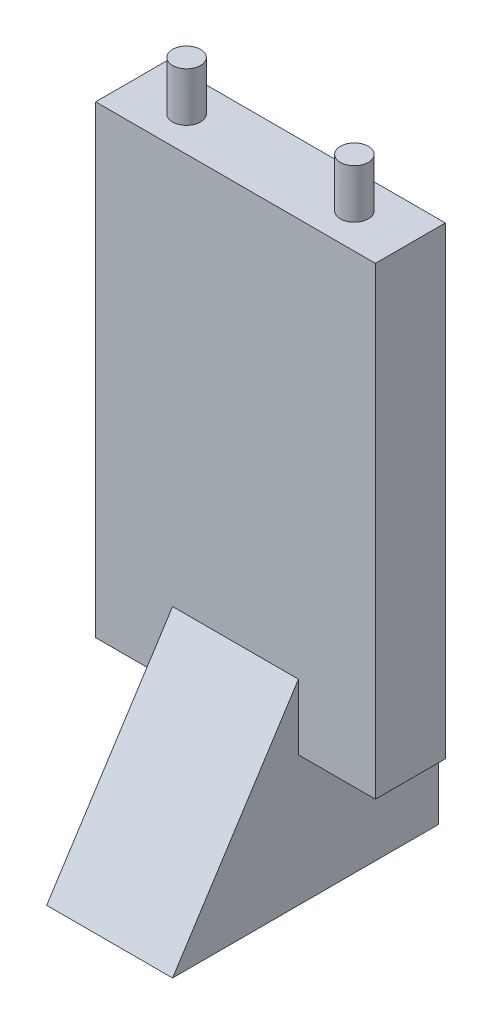
from build123d import *

# Parameters (mm, degrees)
SKETCH1_W           = 101.6
SKETCH1_H           = 25.4
BOSS_EXTRUDE1_DEPTH = 215.9
SKETCH2_R           = 5.08
BOSS_EXTRUDE2_DEPTH = 17.78
SKETCH3_W           = 27.94
SKETCH3_H           = 47.346080225
CUT_EXTRUDE1_DEPTH  = 27.686
SKETCH9_W           = 45.72
SKETCH9_H           = 71.12
BOSS_EXTRUDE5_DEPTH = 45.72
CUT_EXTRUDE4_DEPTH  = 45.72
BOSS_EXTRUDE6_DEPTH = 25.4
SKETCH12_R          = 3.175
CUT_EXTRUDE5_DEPTH  = 12.7


with BuildPart() as part:
    # Sketch1 → Boss-Extrude1 (new body)
    with BuildSketch(Plane(origin=(0, 0, 0), x_dir=(1, 0, 0), z_dir=(0, 1, 0))):
        with Locations((29.457987906, 2.028993953)):
            Rectangle(SKETCH1_W, SKETCH1_H)
    extrude(amount=BOSS_EXTRUDE1_DEPTH)

    # Sketch2 → Boss-Extrude2 (add)
    with BuildSketch(Plane(origin=(0, 215.9, 0), x_dir=(1, 0, 0), z_dir=(0, 1, 0))):
        with Locations((-1.022012094, 2.028993953)):
            Circle(SKETCH2_R)
        with Locations((59.937987906, 2.028993953)):
            Circle(SKETCH2_R)
    extrude(amount=BOSS_EXTRUDE2_DEPTH)

    # Sketch3 → Cut-Extrude1 (cut)
    with BuildSketch(Plane.XY.offset(10.671006047)):
        with Locations((-7.372012094, 23.673040113)):
            Rectangle(SKETCH3_W, SKETCH3_H)
        with Locations((66.287987906, 23.673040113)):
            Rectangle(SKETCH3_W, SKETCH3_H)
    extrude(amount=-CUT_EXTRUDE1_DEPTH, mode=Mode.SUBTRACT)

    # Sketch9 → Boss-Extrude5 (add)
    with BuildSketch(Plane.XY.offset(10.671006047)):
        with Locations((29.457987906, 35.56)):
            Rectangle(SKETCH9_W, SKETCH9_H)
    extrude(amount=BOSS_EXTRUDE5_DEPTH)

    # Sketch10 → Cut-Extrude4 (cut)
    with BuildSketch(Plane(origin=(52.317987906, 0, 0), x_dir=(0, 0, -1), z_dir=(1, 0, 0))):
        Polygon((-56.391006047, 71.12), (-10.671006047, 71.12), (-56.391006047, 0), align=None)
    extrude(amount=-CUT_EXTRUDE4_DEPTH, mode=Mode.SUBTRACT)

    # Sketch11 → Boss-Extrude6 (add)
    with BuildSketch(Plane(origin=(0, 0, -14.728993953), x_dir=(-1, 0, 0), z_dir=(0, 0, -1))):
        Polygon((-52.317987906, 47.346080225), (-52.317987906, 70.979374422), (-6.597987906, 70.979374422), (-6.597987906, 47.346080225), (-6.597987906, 0), (-52.317987906, 0), align=None)
    extrude(amount=BOSS_EXTRUDE6_DEPTH)

    # Sketch12 → Cut-Extrude5 (cut)
    with BuildSketch(Plane.XZ):
        with Locations((29.457987906, -21.078993953)):
            Circle(SKETCH12_R)
        with Locations((29.457987906, 17.021006047)):
            Circle(SKETCH12_R)
    extrude(amount=-CUT_EXTRUDE5_DEPTH, mode=Mode.SUBTRACT)


solid = part.part
